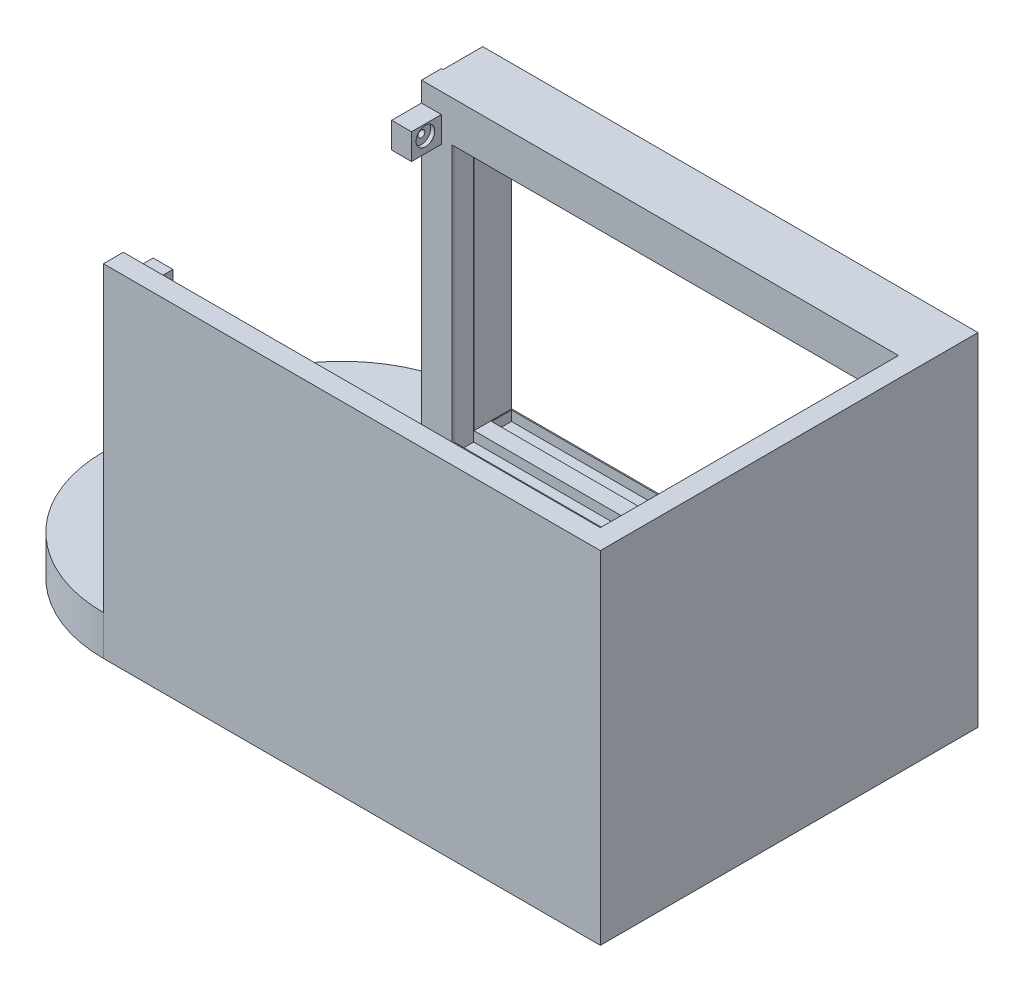
from build123d import *

# Parameters (mm, degrees)
BOSS_EXTRUDE1_DEPTH     = 172
BOSS_EXTRUDE2_DEPTH     = 20
SKETCH2_W               = 10
SKETCH2_H               = 13
BOSS_EXTRUDE3_DEPTH     = 15
SKETCH6_W               = 7
SKETCH6_H               = 82.975623271
BOSS_EXTRUDE4_DEPTH     = 15
SKETCH9_W               = 249.172322426
SKETCH9_H               = 172
BOSS_EXTRUDE7_DEPTH     = 20
CUT_EXTRUDE3_DEPTH      = 75
CUT_EXTRUDE3_DEPTH_BACK = 75
SKETCH11_W              = 220
SKETCH11_H              = 130
CUT_EXTRUDE4_DEPTH      = 135
CUT_EXTRUDE4_DEPTH_BACK = 5
SKETCH12_W              = 220
SKETCH12_H              = 10
FILLET2_R               = 70


with BuildPart() as part:
    # Sketch1 → Boss-Extrude1 (new body)
    with BuildSketch(Plane(origin=(0, 0, 0), x_dir=(1, 0, 0), z_dir=(0, 1, 0))):
        Polygon((-125, -75), (-125, -85), (125, -85), (125, 85), (-125, 85), (-125, 75), (115, 75), (115, -75), align=None)
    extrude(amount=BOSS_EXTRUDE1_DEPTH)

    # Sketch1<3> → Boss-Extrude2 (add)
    with BuildSketch(Plane(origin=(0, 0, 0), x_dir=(1, 0, 0), z_dir=(0, 1, 0))):
        Polygon((-195, -85), (-125, -85), (-125, -75), (115, -75), (115, 75), (-125, 75), (-125, 105), (-195, 105), align=None)
    extrude(amount=BOSS_EXTRUDE2_DEPTH)

    # Sketch2 → Boss-Extrude3 (add)
    with BuildSketch(Plane.XY.offset(-75)):
        with Locations((-120, 155.5)):
            Rectangle(SKETCH2_W, SKETCH2_H)
    boss_extrude3 = extrude(amount=BOSS_EXTRUDE3_DEPTH)

    # Sketch5 → CBORE for M3 Hex Head Cap Screw1 (revolve, cut)
    with BuildSketch(Plane(origin=(-115, 156.612141417, -67), x_dir=(0, 0, -1), z_dir=(0, 1, 0))):
        Polygon((0, 0), (0, 80), (1.7, 80), (1.7, 2), (4.6755, 2), (4.6755, 0.025), (4.7005, 0), align=None)
    cbore_for_m3_hex_head_cap_screw1 = revolve(axis=Axis((-108.65, 156.612141417, -67), (-1, 0, 0)), mode=Mode.SUBTRACT)

    # Mirror1: Boss-Extrude3, CBORE for M3 Hex Head Cap Screw1 across plane
    add(boss_extrude3.mirror(Plane.XY))
    add(cbore_for_m3_hex_head_cap_screw1.mirror(Plane.XY), mode=Mode.SUBTRACT)

    # Sketch6 → Boss-Extrude4 (add)
    with BuildSketch(Plane(origin=(0, 0, 75), x_dir=(-1, 0, 0), z_dir=(0, 0, -1))):
        with Locations((110.877553526, 61.319998757)):
            Rectangle(SKETCH6_W, SKETCH6_H)
        with Locations((63.877553526, 61.191761533)):
            Rectangle(SKETCH6_W, SKETCH6_H)
    extrude(amount=BOSS_EXTRUDE4_DEPTH)

    # Sketch9 → Boss-Extrude7 (add)
    with BuildSketch(Plane(origin=(0, 0, -85), x_dir=(-1, 0, 0), z_dir=(0, 0, -1))):
        with Locations((-0.413838787, 86)):
            Rectangle(SKETCH9_W, SKETCH9_H)
    extrude(amount=BOSS_EXTRUDE7_DEPTH)

    # Sketch11 → Cut-Extrude3 (cut, two sides: drawn at the far end of the back side and taken through both)
    with BuildSketch(Plane(origin=(0, 0, -105), x_dir=(-1, 0, 0), z_dir=(0, 0, -1)).offset(-CUT_EXTRUDE3_DEPTH_BACK)):
        with Locations((-0.413838787, 86.484091926)):
            Rectangle(SKETCH11_W, SKETCH11_H)
    extrude(amount=CUT_EXTRUDE3_DEPTH + CUT_EXTRUDE3_DEPTH_BACK, mode=Mode.SUBTRACT)

    # Sketch12 → Cut-Extrude4 (cut, two sides: drawn at the far end of the back side and taken through both)
    with BuildSketch(Plane(origin=(0, 21.484091926, 0), x_dir=(1, 0, 0), z_dir=(0, 1, 0)).offset(-CUT_EXTRUDE4_DEPTH_BACK)):
        with Locations((0.863655378, 99.416077233)):
            Rectangle(SKETCH12_W, SKETCH12_H)
        with Locations((0.307194527, 80.981434553)):
            Rectangle(SKETCH12_W, SKETCH12_H)
    extrude(amount=CUT_EXTRUDE4_DEPTH + CUT_EXTRUDE4_DEPTH_BACK, mode=Mode.SUBTRACT)

    # Fillet2
    fillet2_edges = [part.edges().sort_by_distance(p)[0] for p in [
        (-195, 10, 85),
        (-195, 10, -105),
    ]]
    fillet(fillet2_edges, radius=FILLET2_R - 0.0001)  # a hair under: the kernel refuses the full size


solid = part.part
